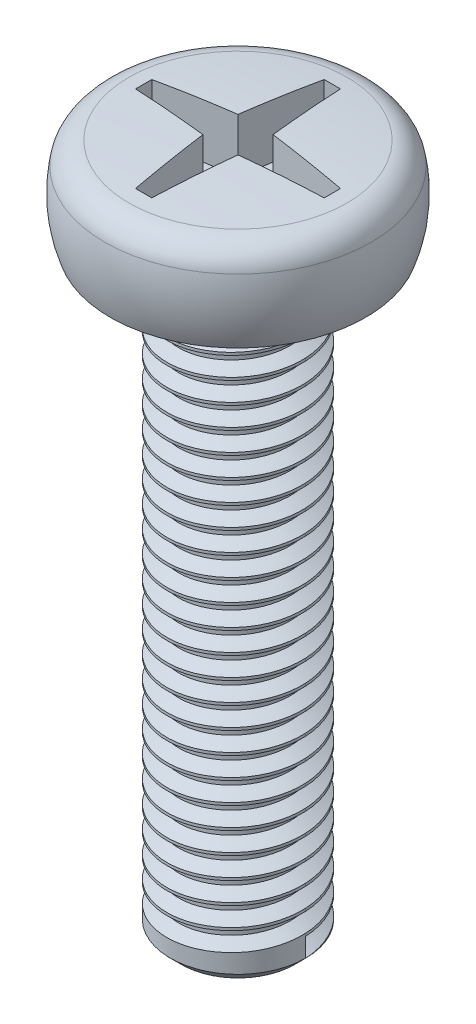
from build123d import *

# Parameters (mm, degrees)
FILLET1_R                 = 1
CUT_EXTRUDE1_REACH        = 11.89
CUT_EXTRUDE1_START_RADIUS = 44.099225113
CUT_EXTRUDE1_END_RADIUS   = 44.099225113
SKETCH3_R                 = 2.5
BOSS_EXTRUDE1_DEPTH       = 22
CHAMFER1_SIZE             = 0.4
THREAD1_PITCH             = 0.8
SCALE1_SCALE              = 0.6


with BuildPart() as part:
    # Sketch1 → Revolve1 (revolve)
    with BuildSketch(Plane.XY):
        with BuildLine():
            Line((4.713877262, -0.272833551), (0, -0.272833551))
            Line((0, -0.272833551), (0, 3.227166449))
            ThreePointArc((0, 3.227166449), (2.360325965, 3.163955199), (4.713885409, 2.97450266))
            ThreePointArc((4.713885409, 2.97450266), (5, 1.350833837), (4.713877262, -0.272833551))
        make_face()
    revolve(axis=Axis((0, 3.227166449, 0), (0, -1, 0)))

    # Fillet1
    fillet1_edges = [part.edges().sort_by_distance(p)[0] for p in [
        (-4.713885409, 2.97450266, 0),
    ]]
    fillet(fillet1_edges, radius=FILLET1_R)

    # Cut-Extrude1: from a sphere face, 11.89 long prism both ways, kept between that surface and its translate by the depth
    cut_extrude1_start = Location((0, -40.872058664, 0)) * Sphere(CUT_EXTRUDE1_START_RADIUS, mode=Mode.PRIVATE)
    cut_extrude1_end = Location((0, -42.872058664, 0)) * Sphere(CUT_EXTRUDE1_END_RADIUS, mode=Mode.PRIVATE)
    # Sketch2 → Cut-Extrude1 (cut, from a surface)
    with BuildSketch(Plane.XZ.offset(0.272833551), mode=Mode.PRIVATE) as cut_extrude1_sk1:
        Polygon((-0.3, -3.485046478), (0.3, -3.485046478), (0.64729074, -0.64729074), (3.485046478, -0.3), (3.485046478, 0.3), (0.64729074, 0.64729074), (0.3, 3.485046478), (-0.3, 3.485046478), (-0.64729074, 0.64729074), (-3.485046478, 0.3), (-3.485046478, -0.3), (-0.64729074, -0.64729074), align=None)
    cut_extrude1_tool1 = extrude(cut_extrude1_sk1.sketch, amount=CUT_EXTRUDE1_REACH, both=True, mode=Mode.PRIVATE)
    add(((cut_extrude1_tool1 & cut_extrude1_start) - cut_extrude1_end).solids().sort_by_distance((0, 2.152942, 0))[0], mode=Mode.SUBTRACT)

    # Sketch3 → Boss-Extrude1 (add)
    with BuildSketch(Plane.XZ.offset(0.272833551)):
        Circle(SKETCH3_R)
    extrude(amount=BOSS_EXTRUDE1_DEPTH)

    # Chamfer1
    chamfer1_edges = [part.edges().sort_by_distance(p)[0] for p in [
        (-2.5, -22.272833551, 0),
    ]]
    chamfer(chamfer1_edges, length=CHAMFER1_SIZE)

    # Thread1: the profile of Thread Profile1 profile screwed along a right-hand helix of 25.75 turns, 8 arcs to a turn; built about Z, then put on its axis
    thread1_z = Axis((0, 0, 0), (0, 0, 1))
    thread1_corners = [(2.5003, 0, -0.000173205), (2.5003, 0, 0.700173203), (2.0669873, 0, 0.449999999), (2.0669873, 0, 0.249999999)]
    with BuildLine(mode=Mode.PRIVATE) as thread1_profile:
        Line(thread1_corners[0], thread1_corners[1])
        Line(thread1_corners[1], thread1_corners[2])
        Line(thread1_corners[2], thread1_corners[3])
        Line(thread1_corners[3], thread1_corners[0])
    thread1_cap = Face(thread1_profile.wire())
    thread1_turn_angles = [0, 22.5, 45, 67.5, 90, 112.5, 135, 157.5, 180, 202.5, 225, 247.5, 270, 292.5, 315, 337.5, 360]
    thread1_turn_weights = [1, 0.9238795325112867, 1, 0.9238795325112867, 1, 0.9238795325112867, 1, 0.9238795325112867, 1, 0.9238795325112867, 1, 0.9238795325112867, 1, 0.9238795325112867, 1, 0.9238795325112867, 1]
    thread1_turn_rails = [Edge.make_bspline([Vector(p[0], p[1], 0).rotate(thread1_z, thread1_turn_angles[k]) / thread1_turn_weights[k] + Vector(0, 0, p[2] + THREAD1_PITCH * thread1_turn_angles[k] / 360) for k in range(17)], [0, 0, 0, 1, 1, 2, 2, 3, 3, 4, 4, 5, 5, 6, 6, 7, 7, 8, 8, 8], 2, thread1_turn_weights) for p in thread1_corners]
    thread1_turn_sides = [Face.make_surface_from_curves(thread1_turn_rails[p[0]], thread1_turn_rails[p[1]]) for p in [(0, 1), (1, 2), (2, 3), (3, 0)]]
    thread1_turn = Solid(Shell([*thread1_turn_sides, thread1_cap, thread1_cap.rotate(thread1_z, 360).moved(Location((0, 0, THREAD1_PITCH * 360 / 360)))]))
    thread1_last_angles = [9000, 9022.5, 9045, 9067.5, 9090, 9112.5, 9135, 9157.5, 9180, 9202.5, 9225, 9247.5, 9270]
    thread1_last_weights = [1, 0.9238795325112867, 1, 0.9238795325112867, 1, 0.9238795325112867, 1, 0.9238795325112867, 1, 0.9238795325112867, 1, 0.9238795325112928, 1]
    thread1_last_rails = [Edge.make_bspline([Vector(p[0], p[1], 0).rotate(thread1_z, thread1_last_angles[k]) / thread1_last_weights[k] + Vector(0, 0, p[2] + THREAD1_PITCH * thread1_last_angles[k] / 360) for k in range(13)], [0, 0, 0, 1, 1, 2, 2, 3, 3, 4, 4, 5, 5, 6, 6, 6], 2, thread1_last_weights) for p in thread1_corners]
    thread1_last_sides = [Face.make_surface_from_curves(thread1_last_rails[p[0]], thread1_last_rails[p[1]]) for p in [(0, 1), (1, 2), (2, 3), (3, 0)]]
    thread1_last = Solid(Shell([*thread1_last_sides, thread1_cap.rotate(thread1_z, 9000).moved(Location((0, 0, THREAD1_PITCH * 9000 / 360))), thread1_cap.rotate(thread1_z, 9270).moved(Location((0, 0, THREAD1_PITCH * 9270 / 360)))]))
    thread1_each = [*[thread1_turn.moved(Location((0, 0, THREAD1_PITCH * i))) for i in range(25)], thread1_last]
    add(Plane(origin=(0, -21.872833551, 0), x_dir=(1, 0, 0), z_dir=(0, 1, 0)) * Compound([thread1_each[i] for i in range(0, 26, 2)]), mode=Mode.SUBTRACT)
    add(Plane(origin=(0, -21.872833551, 0), x_dir=(1, 0, 0), z_dir=(0, 1, 0)) * Compound([thread1_each[i] for i in range(1, 26, 2)]), mode=Mode.SUBTRACT)


with BuildPart() as part_1:
    # Scale1: scaled about (0.000789227, -6.37165263, 0.001798964)
    add(part.part.scale(SCALE1_SCALE).moved(Location((0.000315691, -2.548661052, 0.000719586))))


solid = part_1.part
